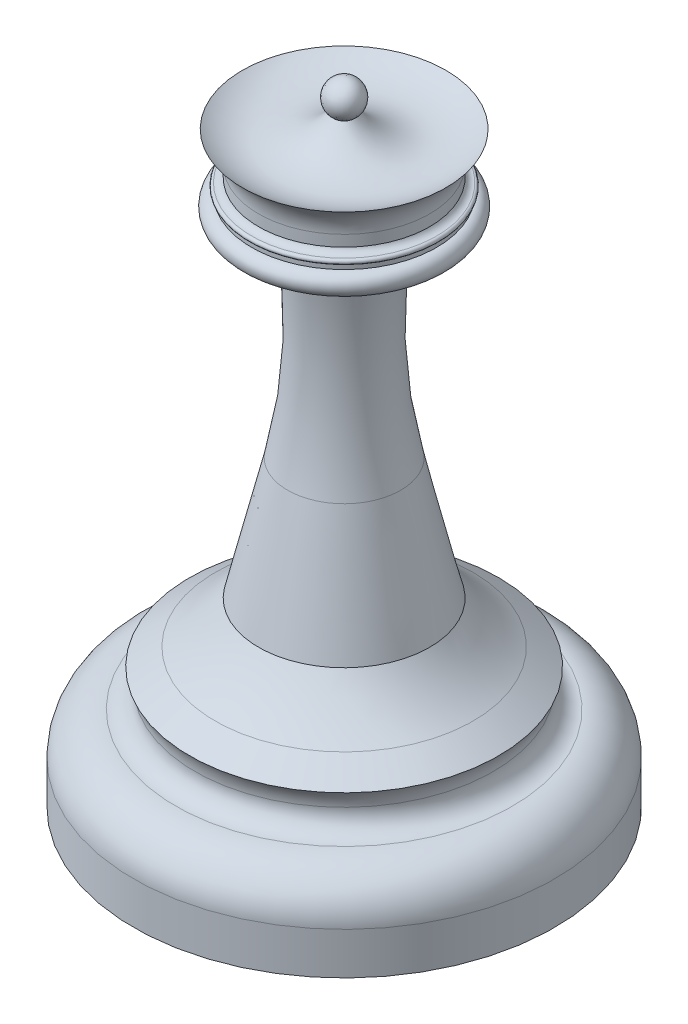
from build123d import *


with BuildPart() as part:
    # Sketch1 → Revolve6 (revolve)
    with BuildSketch(Plane.XY):
        with BuildLine():
            Line((-10, 0), (0, 0))
            Line((0, 0), (0, 30))
            ThreePointArc((0, 30), (-0.755872106, 29.45940086), (-0.491541807, 28.568491457))
            ThreePointArc((-0.491541807, 28.568491457), (-2.532159865, 27.369975842), (-4.840601273, 27.891185976))
            ThreePointArc((-4.840601273, 27.891185976), (-4.355720877, 27.396354372), (-4.097870471, 26.75332989))
            ThreePointArc((-4.097870471, 26.75332989), (-4.075369749, 26.591697232), (-4.067848204, 26.428679365))
            Line((-4.067848204, 26.428679365), (-4.067848204, 25.899516806))
            ThreePointArc((-4.067848204, 25.899516806), (-4.198852853, 25.740176883), (-4.396268259, 25.680355593))
            ThreePointArc((-4.396268259, 25.680355593), (-4.514980583, 25.561643268), (-4.396268259, 25.442930944))
            Line((-4.396268259, 25.442930944), (-4.396268259, 25.209959683))
            ThreePointArc((-4.396268259, 25.209959683), (-4.893328592, 24.712899349), (-4.396268259, 24.215839016))
            Line((-4.396268259, 24.215839016), (-2.441754013, 24.215839016))
            ThreePointArc((-2.441754013, 24.215839016), (-2.049452388, 19.275056103), (-2.689997871, 14.360288781))
            Line((-2.689997871, 14.360288781), (-4.067848204, 8.580358528))
            ThreePointArc((-4.067848204, 8.580358528), (-5.009234386, 7.48422336), (-6.129588017, 6.571793641))
            Line((-6.129588017, 6.571793641), (-7.34669159, 5.748741625))
            ThreePointArc((-7.34669159, 5.748741625), (-7.162152964, 5.375689911), (-7.08398685, 4.966896388))
            ThreePointArc((-7.08398685, 4.966896388), (-7.334228522, 4.286292823), (-8.000321355, 3.999652901))
            ThreePointArc((-8.000321355, 3.999652901), (-9.413980206, 3.413752965), (-9.999653012, 2))
            Line((-9.999653012, 2), (-10, 0))
        make_face()
    revolve(axis=Axis((0, 0, 0), (0, 1, 0)))


solid = part.part
